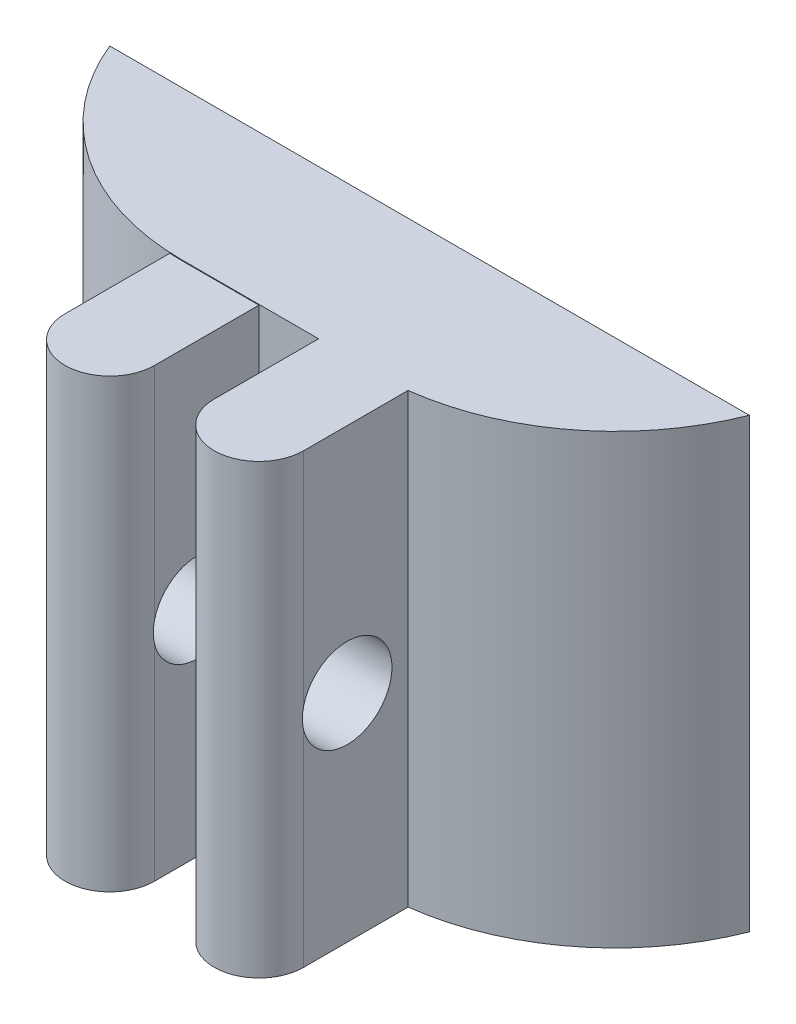
from build123d import *

# Parameters (mm, degrees)
SKETCH1_W               = 22
SKETCH1_H               = 15
BOSS_EXTRUDE1_DEPTH     = 5
SKETCH2_W               = 3
SKETCH2_H               = 15
SKETCH2_H_2             = 14.97636143
BOSS_EXTRUDE2_DEPTH     = 5
CUT_EXTRUDE2_DEPTH      = 22.656407828
CUT_EXTRUDE2_DEPTH_BACK = 22.656407828
SKETCH4_R               = 1.5
FILLET1_R               = 8
FILLET3_RADIUS          = 1.5
FILLET3_LENGTH          = 14.97636143
FILLET4_RADIUS          = 1.5
FILLET4_LENGTH          = 15


with BuildPart() as part:
    # Sketch1 → Boss-Extrude1 (new body)
    with BuildSketch(Plane.XY):
        with Locations((-11, -7.5)):
            Rectangle(SKETCH1_W, SKETCH1_H)
    extrude(amount=BOSS_EXTRUDE1_DEPTH)

    # Sketch2 → Boss-Extrude2 (add)
    with BuildSketch(Plane.XY.offset(5)):
        with Locations((-8.5, -7.5)):
            Rectangle(SKETCH2_W, SKETCH2_H)
        with Locations((-13.5, -7.511819285)):
            Rectangle(SKETCH2_W, SKETCH2_H_2)
    extrude(amount=BOSS_EXTRUDE2_DEPTH)

    # Sketch4 → Cut-Extrude2 (cut, two sides: drawn at the far end of the back side and taken through both)
    with BuildSketch(Plane(origin=(-12, 0, 0), x_dir=(0, 0, -1), z_dir=(1, 0, 0)).offset(-CUT_EXTRUDE2_DEPTH_BACK)):
        with Locations(Location((-7.041389116, -7.762480296, 0), (0, 0, 270))):
            Circle(SKETCH4_R)
    extrude(amount=CUT_EXTRUDE2_DEPTH + CUT_EXTRUDE2_DEPTH_BACK, mode=Mode.SUBTRACT)

    # Fillet1
    # the kernel refuses this fillet: 8 mm, written as the material it takes off along each edge
    with BuildSketch(Plane(origin=(-22, 18.540496218, 5), x_dir=(1, 0, 0), z_dir=(0, -1, 0))) as fillet1_piece_1_section:
        with BuildLine():
            CenterArc((7.416198487, -8), FILLET1_R, 90, 67.975687163)
            Line((0, -5), (0, 0))
            Line((0, 0), (7.416198487, 0))
        make_face()
    fillet1_piece_1 = extrude(amount=52.080992435, mode=Mode.PRIVATE)
    fillet1_piece_1 = split(fillet1_piece_1, bisect_by=Plane(origin=(-22, -0.02363857, 5), z_dir=(0, 1, 0)), keep=Keep.TOP, mode=Mode.PRIVATE)
    add(fillet1_piece_1, mode=Mode.SUBTRACT)
    with BuildSketch(Plane(origin=(-22, 18.540496218, 5), x_dir=(1, 0, 0), z_dir=(0, -1, 0))) as fillet1_piece_2_section:
        with BuildLine():
            CenterArc((7.416198487, -8), FILLET1_R, 90, 67.975687163)
            Line((0, -5), (0, 0))
            Line((0, 0), (7.416198487, 0))
        make_face()
    fillet1_piece_2 = extrude(amount=52.080992435, mode=Mode.PRIVATE)
    fillet1_piece_2 = split(fillet1_piece_2, bisect_by=Plane(origin=(-15, 18.540496218, 5), z_dir=(-1, 0, 0)), keep=Keep.TOP, mode=Mode.PRIVATE)
    add(fillet1_piece_2, mode=Mode.SUBTRACT)
    with BuildSketch(Plane(origin=(0, -34.843134833, 5), x_dir=(0, 0, -1), z_dir=(0, 1, 0))) as fillet1_piece_3:
        with BuildLine():
            CenterArc((7.937253933, 8), FILLET1_R, 187.180755781, 82.819244219)
            Line((0, 7), (0, 0))
            Line((0, 0), (7.937253933, 0))
        make_face()
    extrude(amount=54.686269666, mode=Mode.SUBTRACT)

    # Fillet3: full round fillet: the end face becomes a half cylinder, R = half its width
    fillet3_face = Plane((-13.5, -7.511819285, 10), x_dir=(0, -1, 0), z_dir=(0, 0, 1))  # on the end face: x along it, z out of the body
    fillet3_slab = fillet3_face.offset(-FILLET3_RADIUS / 2) * Box(FILLET3_LENGTH, 2 * FILLET3_RADIUS, FILLET3_RADIUS, mode=Mode.PRIVATE)  # the body's end, R deep
    fillet3_round = Plane((-13.5, -7.511819285, 8.5), x_dir=(0, 0, 1), z_dir=(0, -1, 0)) * Cylinder(FILLET3_RADIUS, FILLET3_LENGTH, mode=Mode.PRIVATE)  # its axis R under the face
    add(fillet3_slab - fillet3_round, mode=Mode.SUBTRACT)

    # Fillet4: full round fillet: the end face becomes a half cylinder, R = half its width
    fillet4_face = Plane((-8.5, -7.5, 10), x_dir=(0, -1, 0), z_dir=(0, 0, 1))  # on the end face: x along it, z out of the body
    fillet4_slab = fillet4_face.offset(-FILLET4_RADIUS / 2) * Box(FILLET4_LENGTH, 2 * FILLET4_RADIUS, FILLET4_RADIUS, mode=Mode.PRIVATE)  # the body's end, R deep
    fillet4_round = Plane((-8.5, -7.5, 8.5), x_dir=(0, 0, 1), z_dir=(0, -1, 0)) * Cylinder(FILLET4_RADIUS, FILLET4_LENGTH, mode=Mode.PRIVATE)  # its axis R under the face
    add(fillet4_slab - fillet4_round, mode=Mode.SUBTRACT)


solid = part.part
